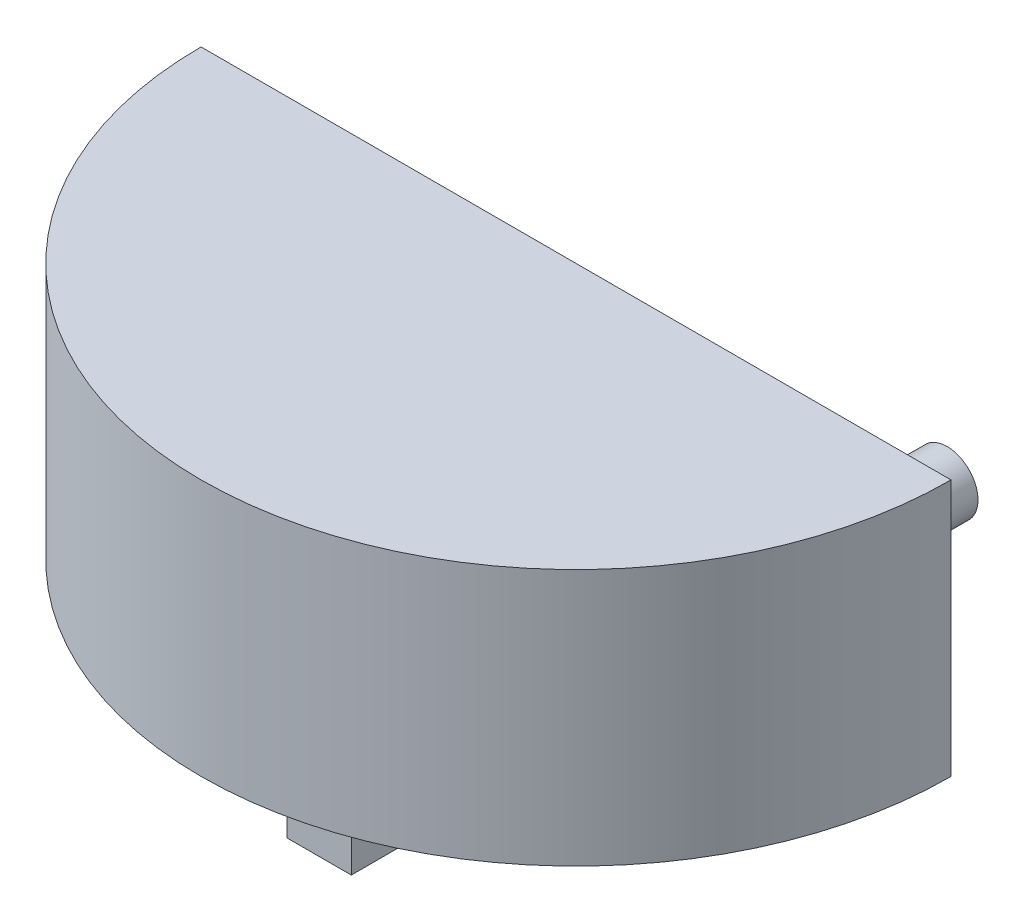
from build123d import *

# Parameters (mm, degrees)
SKETCH2_W           = 19.314156379
SKETCH2_H           = 10.14409312
CUT_EXTRUDE1_DEPTH  = 9.398
SKETCH3_R           = 1.190625
CUT_EXTRUDE2_DEPTH  = 3.048
SKETCH4_R           = 0.762
SKETCH4_R_2         = 0.8255
BOSS_EXTRUDE1_DEPTH = 0.79375
CUT_EXTRUDE3_START  = -1.5875
SKETCH6_R           = 0.8255
CUT_EXTRUDE3_DEPTH  = 1.5875
SKETCH7_W           = 1.5875
SKETCH7_H           = 6.35
BOSS_EXTRUDE2_DEPTH = 3.175


with BuildPart() as part:
    # Sketch1 → Revolve1 (revolve)
    with BuildSketch(Plane.XY):
        Polygon((0, 1.5875), (0, 0), (9.271, 0), (9.271, 6.35), (0, 6.35), (0, 4.7625), (7.6835, 4.7625), (7.6835, 1.5875), align=None)
    revolve(axis=Axis((0, 0, 0), (0, 1, 0)))

    # Sketch2 → Cut-Extrude1 (cut)
    with BuildSketch(Plane(origin=(0, 6.35, 0), x_dir=(1, 0, 0), z_dir=(0, 1, 0))):
        with Locations((0.38607819, 5.07204656)):
            Rectangle(SKETCH2_W, SKETCH2_H)
    extrude(amount=-CUT_EXTRUDE1_DEPTH, mode=Mode.SUBTRACT)

    # Sketch3 → Cut-Extrude2 (cut)
    with BuildSketch(Plane.XZ):
        with Locations((5.30225, 0)):
            Circle(SKETCH3_R)
        with Locations((-5.30225, 0)):
            Circle(SKETCH3_R)
    extrude(amount=-CUT_EXTRUDE2_DEPTH, mode=Mode.SUBTRACT)

    # Sketch4 → Boss-Extrude1 (add)
    with BuildSketch(Plane(origin=(0, 0, 0), x_dir=(-1, 0, 0), z_dir=(0, 0, -1))):
        with Locations((-8.382, 5.461)):
            Circle(SKETCH4_R)
        with Locations((-8.382, 0.889)):
            Circle(SKETCH4_R_2)
        with Locations((8.382, 5.461)):
            Circle(SKETCH4_R_2)
        with Locations((8.382, 0.889)):
            Circle(SKETCH4_R)
    extrude(amount=BOSS_EXTRUDE1_DEPTH)

    # Sketch6 → Cut-Extrude3 (cut)
    with BuildSketch(Plane(origin=(0, 0, -0.79375), x_dir=(-1, 0, 0), z_dir=(0, 0, -1)).offset(CUT_EXTRUDE3_START)):
        with Locations((-8.382, 0.889)):
            Circle(SKETCH6_R)
        with Locations((8.382, 5.461)):
            Circle(SKETCH6_R)
    extrude(amount=CUT_EXTRUDE3_DEPTH, mode=Mode.SUBTRACT)

    # Sketch7 → Boss-Extrude2 (add)
    with BuildSketch(Plane.XZ):
        with Locations((0, 3.175)):
            Rectangle(SKETCH7_W, SKETCH7_H)
    extrude(amount=BOSS_EXTRUDE2_DEPTH)


solid = part.part
